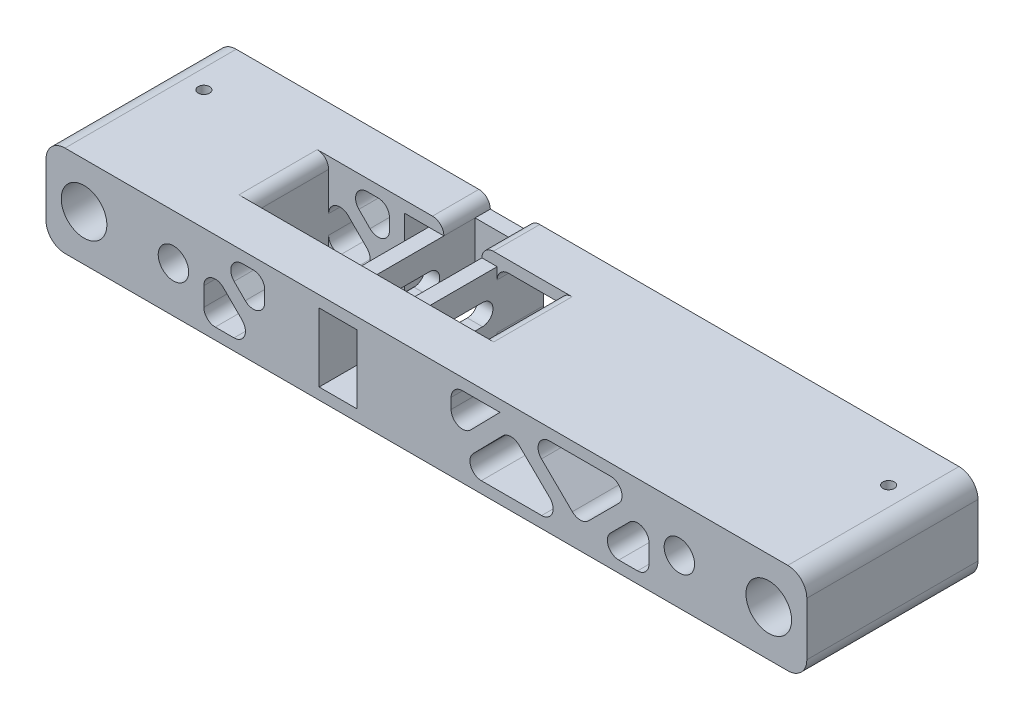
from build123d import *

# Parameters (mm, degrees)
SKETCH1_W           = 100
SKETCH1_H           = 24
SKETCH1_R           = 6
SKETCH1_R_2         = 4
BOSS_EXTRUDE1_DEPTH = 40
SKETCH2_W           = 100
SKETCH2_H           = 24
BOSS_EXTRUDE2_DEPTH = 5
CUT_EXTRUDE1_REACH  = 112.345
SKETCH3_W           = 58.5
SKETCH3_H           = 32.8
SKETCH4_W           = 10
SKETCH4_H           = 18
CUT_EXTRUDE2_DEPTH  = 108.943689023
SKETCH5_W           = 4
SKETCH5_H           = 18
BOSS_EXTRUDE3_DEPTH = 28.8
SKETCH6_W           = 18
SKETCH6_H           = 18
BOSS_EXTRUDE4_DEPTH = 4
CUT_EXTRUDE3_START  = -18
CUT_EXTRUDE3_DEPTH  = 18
SKETCH8_W           = 76.7
SKETCH8_H           = 12.2
SKETCH8_W_2         = 30.3
BOSS_EXTRUDE5_DEPTH = 3
SKETCH13_W          = 12.2
SKETCH13_H          = 3
BOSS_EXTRUDE7_DEPTH = 76.7
SKETCH14_W          = 12.2
SKETCH14_H          = 3
BOSS_EXTRUDE8_DEPTH = 30.3
BOSS_EXTRUDE6_DEPTH = 12.2
SKETCH11_R          = 1.5
CUT_EXTRUDE5_DEPTH  = 111.344913793
CUT_EXTRUDE6_DEPTH  = 4
BOSS_EXTRUDE9_DEPTH = 20.6
SKETCH17_W          = 20.6
SKETCH17_H          = 13.105053006
CUT_EXTRUDE8_DEPTH  = 16.855096
FILLET3_R           = 5
CUT_EXTRUDE9_REACH  = 109.944
FILLET5_R           = 3


with BuildPart() as part:
    # Sketch1 → Boss-Extrude1 (new body)
    with BuildSketch(Plane.XY):
        with Locations((-50, 12)):
            Rectangle(SKETCH1_W, SKETCH1_H)
        with Locations((-90, 12)):
            Circle(SKETCH1_R, mode=Mode.SUBTRACT)
        with Locations((-66.5, 12)):
            Circle(SKETCH1_R_2, mode=Mode.SUBTRACT)
    boss_extrude1 = extrude(amount=BOSS_EXTRUDE1_DEPTH)

    # Sketch2 → Boss-Extrude2 (add)
    with BuildSketch(Plane(origin=(0, 0, 0), x_dir=(-1, 0, 0), z_dir=(0, 0, -1))):
        with Locations((50, 12)):
            Rectangle(SKETCH2_W, SKETCH2_H)
    boss_extrude2 = extrude(amount=BOSS_EXTRUDE2_DEPTH)

    # Sketch3 → Cut-Extrude1 (cut, up to next)
    with BuildSketch(Plane(origin=(0, 24, 0), x_dir=(1, 0, 0), z_dir=(0, 1, 0)), mode=Mode.PRIVATE) as cut_extrude1_sk1:
        with Locations((-29.25, -11.4)):
            Rectangle(SKETCH3_W, SKETCH3_H)
    cut_extrude1_tool1 = extrude(cut_extrude1_sk1.sketch, amount=-CUT_EXTRUDE1_REACH, mode=Mode.PRIVATE) & part.part
    cut_extrude1 = cut_extrude1_tool1.solids().sort_by_distance((-29.25, 24, 11.4))[0]
    add(cut_extrude1, mode=Mode.SUBTRACT)

    # Mirror2: Boss-Extrude1, Boss-Extrude2, Cut-Extrude1 across Right Plane
    add(boss_extrude1.mirror(Plane(origin=(0, 0, 0), x_dir=(0, 0, -1), z_dir=(1, 0, 0))))
    add(boss_extrude2.mirror(Plane(origin=(0, 0, 0), x_dir=(0, 0, -1), z_dir=(1, 0, 0))))
    add(cut_extrude1.mirror(Plane(origin=(0, 0, 0), x_dir=(0, 0, -1), z_dir=(1, 0, 0))), mode=Mode.SUBTRACT)

    # Sketch4 → Cut-Extrude2 (cut, through all)
    with BuildSketch(Plane(origin=(0, 0, 27.8), x_dir=(-1, 0, 0), z_dir=(0, 0, -1))):
        with Locations((23.2, 12)):
            Rectangle(SKETCH4_W, SKETCH4_H)
    extrude(amount=-CUT_EXTRUDE2_DEPTH, mode=Mode.SUBTRACT)

    # Sketch5 → Boss-Extrude3 (add)
    with BuildSketch(Plane(origin=(0, 0, 27.8), x_dir=(-1, 0, 0), z_dir=(0, 0, -1))):
        with Locations((30.2, 12)):
            Rectangle(SKETCH5_W, SKETCH5_H)
        with Locations((16.2, 12)):
            Rectangle(SKETCH5_W, SKETCH5_H)
    extrude(amount=BOSS_EXTRUDE3_DEPTH)

    # Sketch6 → Boss-Extrude4 (add)
    with BuildSketch(Plane(origin=(0, 0, -1), x_dir=(-1, 0, 0), z_dir=(0, 0, -1))):
        with Locations((23.2, 12)):
            Rectangle(SKETCH6_W, SKETCH6_H)
    extrude(amount=BOSS_EXTRUDE4_DEPTH)

    # Sketch7 → Cut-Extrude3 (cut)
    with BuildSketch(Plane(origin=(-14.2, 0, 0), x_dir=(0, 0, -1), z_dir=(1, 0, 0)).offset(CUT_EXTRUDE3_START)):
        with BuildLine():
            Line((-20.05, 14.75), (-11.05, 14.75))
            ThreePointArc((-11.05, 14.75), (-8.3, 12), (-11.05, 9.25))
            Line((-11.05, 9.25), (-20.05, 9.25))
            ThreePointArc((-20.05, 9.25), (-22.8, 12), (-20.05, 14.75))
        make_face()
    extrude(amount=CUT_EXTRUDE3_DEPTH, mode=Mode.SUBTRACT)

    # Sketch8 → Boss-Extrude5 (add)
    with BuildSketch(Plane(origin=(0, 21, 0), x_dir=(1, 0, 0), z_dir=(0, 1, 0))):
        with Locations((20.15, -1.1)):
            Rectangle(SKETCH8_W, SKETCH8_H)
        with Locations((-43.35, -1.1)):
            Rectangle(SKETCH8_W_2, SKETCH8_H)
    extrude(amount=BOSS_EXTRUDE5_DEPTH)

    # Sketch13 → Boss-Extrude7 (add)
    with BuildSketch(Plane.ZY.offset(-58.5)):
        with Locations((1.1, 1.5)):
            Rectangle(SKETCH13_W, SKETCH13_H)
    extrude(amount=BOSS_EXTRUDE7_DEPTH)

    # Sketch14 → Boss-Extrude8 (add)
    with BuildSketch(Plane(origin=(-58.5, 0, 0), x_dir=(0, 0, -1), z_dir=(1, 0, 0))):
        with Locations((-1.1, 1.5)):
            Rectangle(SKETCH14_W, SKETCH14_H)
    extrude(amount=BOSS_EXTRUDE8_DEPTH)

    # Sketch9 → Boss-Extrude6 (add)
    with BuildSketch(Plane(origin=(0, 0, -5), x_dir=(-1, 0, 0), z_dir=(0, 0, -1))):
        Polygon((-58.5, 18.171572875), (-43.328427125, 3), (-37.643941895, 3), (-22.177232561, 18.171703978), (-7.294907133, 3), (-2.493324251, 3), (-2.493324251, 21), (-6.493324251, 21), (-6.493324251, 7.894946994), (-19.348417117, 21), (-25.006058105, 21), (-40.486448643, 5.814875767), (-55.671572875, 21), (-58.5, 21), align=None)
        Polygon((55.671572875, 21), (42.5, 7.828427125), (42.5, 21), (38.5, 21), (38.5, 3), (43.328427125, 3), (58.5, 18.171572875), (58.5, 21), align=None)
    extrude(amount=-BOSS_EXTRUDE6_DEPTH)

    # Sketch11 → Cut-Extrude5 (cut, through all)
    with BuildSketch(Plane(origin=(0, 24, 0), x_dir=(1, 0, 0), z_dir=(0, 1, 0))):
        with Locations(Location((90, -8.5, 0), (0, 0, 180))):
            Circle(SKETCH11_R)
        with Locations(Location((-90, -8.5, 0), (0, 0, 180))):
            Circle(SKETCH11_R)
    extrude(amount=-CUT_EXTRUDE5_DEPTH, mode=Mode.SUBTRACT)

    # Sketch12 → Cut-Extrude6 (cut)
    with BuildSketch(Plane.XZ):
        Polygon((-87.25, 6.91228676), (-87.25, 10.08771324), (-90, 11.675426481), (-92.75, 10.08771324), (-92.75, 6.91228676), (-90, 5.324573519), align=None)
        Polygon((92.75, 10.08771324), (90, 11.675426481), (87.25, 10.08771324), (87.25, 6.91228676), (90, 5.324573519), (92.75, 6.91228676), align=None)
    extrude(amount=-CUT_EXTRUDE6_DEPTH, mode=Mode.SUBTRACT)

    # Sketch15 → Boss-Extrude9 (add)
    with BuildSketch(Plane(origin=(0, 0, 27.8), x_dir=(-1, 0, 0), z_dir=(0, 0, -1))):
        Polygon((-58.5, 18.171572875), (-43.328427125, 3), (-58.5, 3), (-58.5, 0), (-2.493324251, 0), (-2.493324251, 24), (-58.5, 24), align=None)
        Polygon((-6.493324251, 7.894946994), (-19.348417117, 21), (-6.493324251, 21), align=None, mode=Mode.SUBTRACT)
        Polygon((-37.643941895, 3), (-22.177232561, 18.171703978), (-7.294907133, 3), align=None, mode=Mode.SUBTRACT)
        Polygon((-25.006058105, 21), (-55.671572875, 21), (-40.486448643, 5.814875767), align=None, mode=Mode.SUBTRACT)
    extrude(amount=BOSS_EXTRUDE9_DEPTH)

    # Sketch17 → Cut-Extrude8 (cut)
    with BuildSketch(Plane.ZY.offset(-2.493324251)):
        with Locations((17.5, 14.447473497)):
            Rectangle(SKETCH17_W, SKETCH17_H)
    extrude(amount=-CUT_EXTRUDE8_DEPTH, mode=Mode.SUBTRACT)

    # Fillet3
    fillet3_edges = [part.edges().sort_by_distance(p)[0] for p in [
        (100, 0, 17.5),
        (100, 24, 17.5),
        (-100, 0, 17.5),
        (-100, 24, 17.5),
    ]]
    fillet(fillet3_edges, radius=FILLET3_R)

    # Sketch18 → Cut-Extrude9 (cut, up to next)
    with BuildSketch(Plane(origin=(0, 0, 27.8), x_dir=(-1, 0, 0), z_dir=(0, 0, -1)), mode=Mode.PRIVATE) as cut_extrude9_sk1:
        Polygon((-6.493324251, 21), (-6.493324251, 7.894946994), (-19.348417117, 21), align=None)
    cut_extrude9_tool1 = extrude(cut_extrude9_sk1.sketch, amount=-CUT_EXTRUDE9_REACH, mode=Mode.PRIVATE) & part.part
    # Sketch18 → Cut-Extrude9 (cut, up to next)
    with BuildSketch(Plane(origin=(0, 0, 27.8), x_dir=(-1, 0, 0), z_dir=(0, 0, -1)), mode=Mode.PRIVATE) as cut_extrude9_sk2:
        Polygon((-7.294907133, 3), (-37.643941895, 3), (-22.177232561, 18.171703978), align=None)
    cut_extrude9_tool2 = extrude(cut_extrude9_sk2.sketch, amount=-CUT_EXTRUDE9_REACH, mode=Mode.PRIVATE) & part.part
    # Sketch18 → Cut-Extrude9 (cut, up to next)
    with BuildSketch(Plane(origin=(0, 0, 27.8), x_dir=(-1, 0, 0), z_dir=(0, 0, -1)), mode=Mode.PRIVATE) as cut_extrude9_sk3:
        Polygon((-25.006058105, 21), (-40.486448643, 5.814875767), (-55.671572875, 21), align=None)
    cut_extrude9_tool3 = extrude(cut_extrude9_sk3.sketch, amount=-CUT_EXTRUDE9_REACH, mode=Mode.PRIVATE) & part.part
    # Sketch18 → Cut-Extrude9 (cut, up to next)
    with BuildSketch(Plane(origin=(0, 0, 27.8), x_dir=(-1, 0, 0), z_dir=(0, 0, -1)), mode=Mode.PRIVATE) as cut_extrude9_sk4:
        Polygon((-58.5, 18.171572875), (-43.328427125, 3), (-58.5, 3), align=None)
    cut_extrude9_tool4 = extrude(cut_extrude9_sk4.sketch, amount=-CUT_EXTRUDE9_REACH, mode=Mode.PRIVATE) & part.part
    # Sketch18 → Cut-Extrude9 (cut, up to next)
    with BuildSketch(Plane(origin=(0, 0, 27.8), x_dir=(-1, 0, 0), z_dir=(0, 0, -1)), mode=Mode.PRIVATE) as cut_extrude9_sk5:
        Polygon((43.328427125, 3), (58.5, 3), (58.5, 18.171572875), align=None)
    cut_extrude9_tool5 = extrude(cut_extrude9_sk5.sketch, amount=-CUT_EXTRUDE9_REACH, mode=Mode.PRIVATE) & part.part
    # Sketch18 → Cut-Extrude9 (cut, up to next)
    with BuildSketch(Plane(origin=(0, 0, 27.8), x_dir=(-1, 0, 0), z_dir=(0, 0, -1)), mode=Mode.PRIVATE) as cut_extrude9_sk6:
        Polygon((42.5, 21), (55.671572875, 21), (42.5, 7.828427125), align=None)
    cut_extrude9_tool6 = extrude(cut_extrude9_sk6.sketch, amount=-CUT_EXTRUDE9_REACH, mode=Mode.PRIVATE) & part.part
    add(cut_extrude9_tool1.solids().sort_by_distance((10.778355, 16.631649, 27.8))[0], mode=Mode.SUBTRACT)
    add(cut_extrude9_tool2.solids().sort_by_distance((22.372027, 8.057235, 27.8))[0], mode=Mode.SUBTRACT)
    add(cut_extrude9_tool3.solids().sort_by_distance((40.388027, 15.938292, 27.8))[0], mode=Mode.SUBTRACT)
    add(cut_extrude9_tool4.solids().sort_by_distance((53.442809, 8.057191, 27.8))[0], mode=Mode.SUBTRACT)
    add(cut_extrude9_tool5.solids().sort_by_distance((-53.442809, 8.057191, 27.8))[0], mode=Mode.SUBTRACT)
    add(cut_extrude9_tool6.solids().sort_by_distance((-46.890524, 16.609476, 27.8))[0], mode=Mode.SUBTRACT)

    # Fillet5
    # the kernel refuses this fillet: 3 mm, written as the material it adds along each edge
    with BuildSketch(Plane(origin=(-14.2, 21, 7.2), x_dir=(1, 0, 0), z_dir=(0, 0, -1)), Plane(origin=(-14.2, 3, 7.2), x_dir=(0, 1, 0), z_dir=(0, 0, -1)), Plane(origin=(6.493324251, 21, 7.2), x_dir=(1, 0, 0), z_dir=(0, 0, -1)), Plane(origin=(-42.5, 21, 27.8), x_dir=(-1, 0, 0), z_dir=(0, 0, 1))) as fillet5_piece_1:
        with BuildLine():
            CenterArc((FILLET5_R, FILLET5_R), FILLET5_R, 180, 90)
            Line((0, FILLET5_R), (0, 0))
            Line((0, 0), (FILLET5_R, 0))
        make_face()
    extrude(amount=12.2)
    with BuildSketch(Plane(origin=(58.5, 3, -5), x_dir=(-1, 0, 0), z_dir=(0, 0, 1))) as fillet5_piece_2:
        with BuildLine():
            CenterArc((FILLET5_R, -FILLET5_R), FILLET5_R, 90, 90)
            Line((0, -FILLET5_R), (0, 0))
            Line((0, 0), (FILLET5_R, 0))
        make_face()
    extrude(amount=45)
    with BuildSketch(Plane(origin=(-58.5, 3, 7.2), x_dir=(1, 0, 0), z_dir=(0, 0, -1)), Plane(origin=(-42.5, 21, -5), x_dir=(0, -1, 0), z_dir=(0, 0, 1)), Plane(origin=(-58.5, 3, 27.8), x_dir=(0, 1, 0), z_dir=(0, 0, 1)), Plane(origin=(6.493324251, 21, 27.8), x_dir=(1, 0, 0), z_dir=(0, 0, 1))) as fillet5_piece_3:
        with BuildLine():
            CenterArc((FILLET5_R, -FILLET5_R), FILLET5_R, 90, 90)
            Line((0, -FILLET5_R), (0, 0))
            Line((0, 0), (FILLET5_R, 0))
        make_face()
    extrude(amount=12.2)
    with BuildSketch(Plane(origin=(55.671572875, 21, -5), x_dir=(-0.7071067811865559, -0.7071067811865392, 0), z_dir=(0, 0, 1))) as fillet5_piece_4:
        with BuildLine():
            CenterArc((FILLET5_R * 2.41421356237, -FILLET5_R), FILLET5_R, 90, 135)
            Line((FILLET5_R * 1.70710678119, -FILLET5_R * 1.70710678119), (0, 0))
            Line((0, 0), (FILLET5_R * 2.41421356237, 0))
        make_face()
    extrude(amount=45)
    with BuildSketch(Plane(origin=(40.486448643, 5.814875767, -5), x_dir=(0.7071067811865565, 0.7071067811865386, 0), z_dir=(0, 0, 1))) as fillet5_piece_5:
        with BuildLine():
            CenterArc((FILLET5_R * 0.990417743269, FILLET5_R), FILLET5_R, 180.55166171, 89.44833829)
            Line((-FILLET5_R * 0.00953590488174, FILLET5_R * 0.990371835575), (0, 0))
            Line((0, 0), (FILLET5_R * 0.990417743269, 0))
        make_face()
    extrude(amount=45)
    with BuildSketch(Plane(origin=(25.006058105, 21, 40), x_dir=(1, 0, 0), z_dir=(0, 0, -1)), Plane(origin=(37.643941895, 3, 40), x_dir=(-1, 0, 0), z_dir=(0, 0, -1))) as fillet5_piece_6:
        with BuildLine():
            CenterArc((FILLET5_R * 2.44747349713, FILLET5_R), FILLET5_R, 134.44833829, 135.55166171)
            Line((FILLET5_R * 1.747207632, FILLET5_R * 1.71388214583), (0, 0))
            Line((0, 0), (FILLET5_R * 2.44747349713, 0))
        make_face()
    extrude(amount=45)
    with BuildSketch(Plane(origin=(7.294907133, 3, -5), x_dir=(0.7002658651241888, 0.7138821458349212, 0), z_dir=(0, 0, 1))) as fillet5_piece_7_section:
        with BuildLine():
            CenterArc((FILLET5_R * 2.38171787184, -FILLET5_R), FILLET5_R, 90, 134.44833829)
            Line((FILLET5_R * 1.66783572601, -FILLET5_R * 1.70026586512), (0, 0))
            Line((0, 0), (FILLET5_R * 2.38171787184, 0))
        make_face()
    fillet5_piece_7 = extrude(amount=62.862884039, mode=Mode.PRIVATE)
    fillet5_piece_7 = split(fillet5_piece_7, bisect_by=Plane(origin=(12.152987791, 7.9470607, 7.2), z_dir=(0, 0, -1)), keep=Keep.TOP, mode=Mode.PRIVATE)
    add(fillet5_piece_7)
    with BuildSketch(Plane(origin=(7.294907133, 3, -5), x_dir=(0.7002658651241888, 0.7138821458349212, 0), z_dir=(0, 0, 1))) as fillet5_piece_8_section:
        with BuildLine():
            CenterArc((FILLET5_R * 2.38171787184, -FILLET5_R), FILLET5_R, 90, 134.44833829)
            Line((FILLET5_R * 1.66783572601, -FILLET5_R * 1.70026586512), (0, 0))
            Line((0, 0), (FILLET5_R * 2.38171787184, 0))
        make_face()
    fillet5_piece_8 = extrude(amount=45, mode=Mode.PRIVATE)
    fillet5_piece_8 = split(fillet5_piece_8, bisect_by=Plane(origin=(10.449209707, 7.894946994, 17.5), z_dir=(0, -1, 0)), keep=Keep.TOP, mode=Mode.PRIVATE)
    add(fillet5_piece_8)
    with BuildSketch(Plane(origin=(7.294907133, 3, -22.862884039), x_dir=(0.700265865124189, 0.7138821458349209, 0), z_dir=(0, 0, 1))) as fillet5_piece_9_section:
        with BuildLine():
            CenterArc((FILLET5_R * 2.38171787184, -FILLET5_R), FILLET5_R, 90, 134.44833829)
            Line((FILLET5_R * 1.66783572601, -FILLET5_R * 1.70026586512), (0, 0))
            Line((0, 0), (FILLET5_R * 2.38171787184, 0))
        make_face()
    fillet5_piece_9 = extrude(amount=62.862884039, mode=Mode.PRIVATE)
    fillet5_piece_9 = split(fillet5_piece_9, bisect_by=Plane(origin=(12.152987791, 7.9470607, 27.8), z_dir=(0, 0, 1)), keep=Keep.TOP, mode=Mode.PRIVATE)
    add(fillet5_piece_9)
    with BuildSketch(Plane(origin=(22.177232561, 18.171703978, -5), x_dir=(-0.700265865124189, -0.7138821458349208, 0), z_dir=(0, 0, 1))) as fillet5_piece_10:
        with BuildLine():
            CenterArc((FILLET5_R, FILLET5_R), FILLET5_R, 180, 90)
            Line((0, FILLET5_R), (0, 0))
            Line((0, 0), (FILLET5_R, 0))
        make_face()
    extrude(amount=45)
    with BuildSketch(Plane(origin=(43.328427125, 3, -5), x_dir=(1, 0, 0), z_dir=(0, 0, 1)), Plane(origin=(58.5, 18.171572875, 40), x_dir=(0, -1, 0), z_dir=(0, 0, -1))) as fillet5_piece_11:
        with BuildLine():
            CenterArc((FILLET5_R * 2.41421356237, FILLET5_R), FILLET5_R, 135, 135)
            Line((FILLET5_R * 1.70710678119, FILLET5_R * 1.70710678119), (0, 0))
            Line((0, 0), (FILLET5_R * 2.41421356237, 0))
        make_face()
    extrude(amount=45)
    with BuildSketch(Plane(origin=(-58.5, 18.171572875, -5), x_dir=(0.7071067811865434, -0.7071067811865517, 0), z_dir=(0, 0, 1)), Plane(origin=(-43.328427125, 3, -5), x_dir=(-1, 0, 0), z_dir=(0, 0, 1)), Plane(origin=(-55.671572875, 21, -5), x_dir=(1, 0, 0), z_dir=(0, 0, 1)), Plane(origin=(-42.5, 7.828427125, 27.8), x_dir=(-0.707106781186544, 0.707106781186551, 0), z_dir=(0, 0, 1)), Plane(origin=(-55.671572875, 21, 27.8), x_dir=(1, 0, 0), z_dir=(0, 0, 1))) as fillet5_piece_12:
        with BuildLine():
            CenterArc((FILLET5_R * 2.41421356237, -FILLET5_R), FILLET5_R, 90, 135)
            Line((FILLET5_R * 1.70710678119, -FILLET5_R * 1.70710678119), (0, 0))
            Line((0, 0), (FILLET5_R * 2.41421356237, 0))
        make_face()
    extrude(amount=12.2)
    with BuildSketch(Plane(origin=(-42.5, 7.828427125, -5), x_dir=(0, 1, 0), z_dir=(0, 0, 1)), Plane(origin=(-43.328427125, 3, 27.8), x_dir=(-0.7071067811865439, 0.7071067811865511, 0), z_dir=(0, 0, 1)), Plane(origin=(-58.5, 18.171572875, 27.8), x_dir=(0, -1, 0), z_dir=(0, 0, 1))) as fillet5_piece_13:
        with BuildLine():
            CenterArc((FILLET5_R * 2.41421356237, FILLET5_R), FILLET5_R, 135, 135)
            Line((FILLET5_R * 1.70710678119, FILLET5_R * 1.70710678119), (0, 0))
            Line((0, 0), (FILLET5_R * 2.41421356237, 0))
        make_face()
    extrude(amount=12.2)
    with BuildSketch(Plane(origin=(6.493324251, 7.894946994, -5), x_dir=(0, 1, 0), z_dir=(0, 0, 1)), Plane(origin=(6.493324251, 7.894946994, 27.8), x_dir=(0, 1, 0), z_dir=(0, 0, 1))) as fillet5_piece_14:
        with BuildLine():
            CenterArc((FILLET5_R * 2.44747349713, -FILLET5_R), FILLET5_R, 90, 135.55166171)
            Line((FILLET5_R * 1.747207632, -FILLET5_R * 1.71388214583), (0, 0))
            Line((0, 0), (FILLET5_R * 2.44747349713, 0))
        make_face()
    extrude(amount=12.2)
    # the kernel refuses this fillet: 3 mm, written as the material it takes off along each edge
    with BuildSketch(Plane(origin=(-18.2, 24, 14.7), x_dir=(1, 0, 0), z_dir=(0, 0, -1))) as fillet5_2_piece_1:
        with BuildLine():
            CenterArc((FILLET5_R, FILLET5_R), FILLET5_R, 180, 90)
            Line((0, FILLET5_R), (0, 0))
            Line((0, 0), (FILLET5_R, 0))
        make_face()
    extrude(amount=27.2, mode=Mode.SUBTRACT)
    with BuildSketch(Plane(origin=(-58.5, 24, 7.2), x_dir=(-1, 0, 0), z_dir=(0, 0, 1)), Plane(origin=(2.493324251, 24, 27.8), x_dir=(1, 0, 0), z_dir=(0, 0, -1))) as fillet5_2_piece_2:
        with BuildLine():
            CenterArc((FILLET5_R, FILLET5_R), FILLET5_R, 180, 90)
            Line((0, FILLET5_R), (0, 0))
            Line((0, 0), (FILLET5_R, 0))
        make_face()
    extrude(amount=20.6, mode=Mode.SUBTRACT)
    with BuildSketch(Plane(origin=(-28.2, 24, 14.7), x_dir=(-1, 0, 0), z_dir=(0, 0, -1)), Plane(origin=(-28.2, 0, -12.5), x_dir=(-1, 0, 0), z_dir=(0, 0, 1))) as fillet5_2_piece_3:
        with BuildLine():
            CenterArc((FILLET5_R, -FILLET5_R), FILLET5_R, 90, 90)
            Line((0, -FILLET5_R), (0, 0))
            Line((0, 0), (FILLET5_R, 0))
        make_face()
    extrude(amount=27.2, mode=Mode.SUBTRACT)
    with BuildSketch(Plane(origin=(2.493324251, 0, 27.8), x_dir=(1, 0, 0), z_dir=(0, 0, -1)), Plane(origin=(-58.5, 0, 7.2), x_dir=(-1, 0, 0), z_dir=(0, 0, 1))) as fillet5_2_piece_4:
        with BuildLine():
            CenterArc((FILLET5_R, -FILLET5_R), FILLET5_R, 90, 90)
            Line((0, -FILLET5_R), (0, 0))
            Line((0, 0), (FILLET5_R, 0))
        make_face()
    extrude(amount=20.6, mode=Mode.SUBTRACT)


solid = part.part
